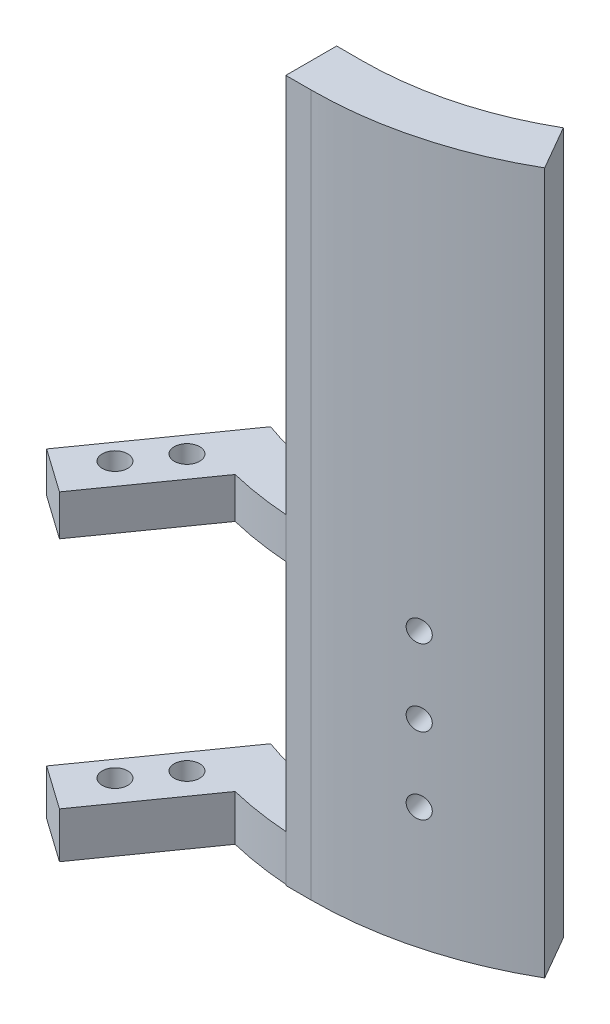
from build123d import *

# Parameters (mm, degrees)
BOSS_EXTRUDE2_DEPTH = 20
FILLET1_RADIUS      = 10
FILLET1_LENGTH      = 5
FILLET2_RADIUS      = 10
FILLET2_LENGTH      = 5
SKETCH5_R           = 1
SKETCH5_R_2         = 5.5
CUT_EXTRUDE5_DEPTH  = 69.007352544
CUT_EXTRUDE7_DEPTH  = 25
FILLET5_R           = 10
BOSS_EXTRUDE5_DEPTH = 60
SKETCH13_R          = 2.1
CUT_EXTRUDE8_DEPTH  = 60
CUT_EXTRUDE9_DEPTH  = 60
CUT_EXTRUDE10_DEPTH = 60
SKETCH17_R          = 2.5
BOSS_EXTRUDE6_DEPTH = 8
SKETCH18_R          = 2.5
BOSS_EXTRUDE7_DEPTH = 9
BOSS_EXTRUDE8_DEPTH = 69


with BuildPart() as part:
    # Sketch1 → Boss-Extrude2 (new body)
    with BuildSketch(Plane.XY):
        Polygon((-25, 30), (25, 30), (25, -30), (-25, -30), (-25, -25), (-20, -25), (20, -25), (20, 25), (-20, 25), (-25, 25), align=None)
    extrude(amount=BOSS_EXTRUDE2_DEPTH)

    # Fillet1: full round fillet: the end face becomes a half cylinder, R = half its width
    fillet1_face = Plane((-25, 27.5, 10), x_dir=(0, -1, 0), z_dir=(-1, 0, 0))  # on the end face: x along it, z out of the body
    fillet1_slab = fillet1_face.offset(-FILLET1_RADIUS / 2) * Box(FILLET1_LENGTH, 2 * FILLET1_RADIUS, FILLET1_RADIUS, mode=Mode.PRIVATE)  # the body's end, R deep
    fillet1_round = Plane((-15, 27.5, 10), x_dir=(-1, 0, 0), z_dir=(0, -1, 0)) * Cylinder(FILLET1_RADIUS, FILLET1_LENGTH, mode=Mode.PRIVATE)  # its axis R under the face
    add(fillet1_slab - fillet1_round, mode=Mode.SUBTRACT)

    # Fillet2: full round fillet: the end face becomes a half cylinder, R = half its width
    fillet2_face = Plane((-25, -27.5, 10), x_dir=(0, -1, 0), z_dir=(-1, 0, 0))  # on the end face: x along it, z out of the body
    fillet2_slab = fillet2_face.offset(-FILLET2_RADIUS / 2) * Box(FILLET2_LENGTH, 2 * FILLET2_RADIUS, FILLET2_RADIUS, mode=Mode.PRIVATE)  # the body's end, R deep
    fillet2_round = Plane((-15, -27.5, 10), x_dir=(-1, 0, 0), z_dir=(0, -1, 0)) * Cylinder(FILLET2_RADIUS, FILLET2_LENGTH, mode=Mode.PRIVATE)  # its axis R under the face
    add(fillet2_slab - fillet2_round, mode=Mode.SUBTRACT)

    # Sketch5 → Cut-Extrude5 (cut, through all)
    with BuildSketch(Plane(origin=(0, 30, 0), x_dir=(1, 0, 0), z_dir=(0, 1, 0))):
        with Locations(Location((-15, -3, 0), (0, 0, 180))):
            Circle(SKETCH5_R)
        with Locations(Location((-22, -10, 0), (0, 0, 180))):
            Circle(SKETCH5_R)
        with Locations(Location((-15, -17, 0), (0, 0, 180))):
            Circle(SKETCH5_R)
        with Locations(Location((-8, -10, 0), (0, 0, 180))):
            Circle(SKETCH5_R)
        with Locations(Location((-15, -10, 0), (0, 0, 180))):
            Circle(SKETCH5_R_2)
    extrude(amount=-CUT_EXTRUDE5_DEPTH, mode=Mode.SUBTRACT)

    # Sketch10 → Cut-Extrude7 (cut)
    with BuildSketch(Plane(origin=(25, 0, 0), x_dir=(0, 0, -1), z_dir=(1, 0, 0))):
        Polygon((-15, 28.180148829), (-15, -28.180148829), (-15, -30), (-20, -30), (-20, 30), (-15, 30), align=None)
        Polygon((-5, 28.180148829), (-5, -28.180148829), (-5, -30), (0, -30), (0, 30), (-5, 30), align=None)
    extrude(amount=-CUT_EXTRUDE7_DEPTH, mode=Mode.SUBTRACT)

    # Fillet5
    # the kernel refuses this fillet: 10 mm, written as the material it adds along each edge
    with BuildSketch(Plane(origin=(0, 25, 15), x_dir=(1, 0, 0), z_dir=(0, 1, 0)), Plane(origin=(0, -30, 15), x_dir=(1, 0, 0), z_dir=(0, 1, 0)), Plane(origin=(0, -25, 5), x_dir=(1, 0, 0), z_dir=(0, -1, 0))) as fillet5_piece_1:
        with BuildLine():
            CenterArc((8.660254038, -10), FILLET5_R, 90, 60)
            Line((0, -5), (-0.173205081, -4.9))
            ThreePointArc((-0.173205081, -4.9), (-0.2, -2.5), (-0.2, 0))
            Line((-0.2, 0), (0, 0.2))
            Line((0, 0.2), (8.660254038, 0.2))
            Line((8.660254038, 0.2), (8.660254038, 0))
        make_face()
    extrude(amount=5)
    with BuildSketch(Plane(origin=(0, 30, 5), x_dir=(0, 0, -1), z_dir=(0, -1, 0))) as fillet5_piece_2:
        with BuildLine():
            CenterArc((10, 8.660254038), FILLET5_R, 180, 60)
            Line((0, 8.660254038), (-0.2, 8.660254038))
            Line((-0.2, 8.660254038), (-0.2, 0))
            Line((-0.2, 0), (0, -0.2))
            ThreePointArc((0, -0.2), (2.5, -0.2), (4.9, -0.173205081))
            Line((4.9, -0.173205081), (5, 0))
        make_face()
    extrude(amount=5)

    # Sketch12 → Boss-Extrude5 (add)
    with BuildSketch(Plane.XZ.offset(30)):
        with BuildLine():
            Line((56.226298398, -3.359735054), (61.222506141, 5.302707337))
            ThreePointArc((61.222506141, 5.302707337), (43.74904955, 12.533728595), (25, 15))
            Line((25, 15), (25, 5))
            ThreePointArc((25, 5), (41.16297375, 2.873903962), (56.226298398, -3.359735054))
        make_face()
    extrude(amount=-BOSS_EXTRUDE5_DEPTH)

    # Sketch13 → Cut-Extrude8 (cut)
    with BuildSketch(Plane(origin=(2.920998947, 0, 10.910870277), x_dir=(-0.9659824633840055, 0, 0.2586075800021504), z_dir=(-0.2586075800021504, 0, -0.9659824633840055))):
        with Locations((-39.019497435, 15)):
            Circle(SKETCH13_R)
        with Locations((-39.019497435, 0)):
            Circle(SKETCH13_R)
        with Locations((-39.019497435, -15)):
            Circle(SKETCH13_R)
    extrude(amount=-CUT_EXTRUDE8_DEPTH, mode=Mode.SUBTRACT)

    # Sketch15 → Cut-Extrude9 (cut)
    with BuildSketch(Plane(origin=(0, 30, 0), x_dir=(1, 0, 0), z_dir=(0, 1, 0))):
        with BuildLine():
            Line((8.660254038, -5), (8.660254038, -15))
            ThreePointArc((8.660254038, -15), (-39.182795974, -10), (8.660254038, -5))
        make_face()
    extrude(amount=-CUT_EXTRUDE9_DEPTH, mode=Mode.SUBTRACT)

    # Sketch16 → Cut-Extrude10 (cut)
    with BuildSketch(Plane(origin=(0, 30, 0), x_dir=(1, 0, 0), z_dir=(0, 1, 0))):
        Polygon((-6.307906019, -33.220384693), (8.660254038, -15), (20.000254038, -15), (20.000254038, -5), (8.660254038, -5), (3.496355525, -1.350438774), (-14.790578774, -27.225295226), align=None)
    extrude(amount=-CUT_EXTRUDE10_DEPTH, mode=Mode.SUBTRACT)

    # Sketch17 → Boss-Extrude6 (add)
    # profile 1 of 2: a face of its own
    with BuildSketch(Plane(origin=(0, 16, 0), x_dir=(1, 0, 0), z_dir=(0, 1, 0))):
        Polygon((2.432023453, -2.661202229), (-1.062108246, -7.605177784), (-12.605177784, -23.937891754), (-14.882580853, -27.160273185), (-8.757813114, -31.488924262), (-6.307906019, -33.220384693), (7.998117102, -12.978265997), (11.006698288, -8.721313737), align=None)
        with Locations(Location((-6.090722034, -22.517234763, 0), (0, 0, 180))):
            Circle(SKETCH17_R, mode=Mode.SUBTRACT)
        with Locations(Location((-0.226842709, -14.220216066, 0), (0, 0, 180))):
            Circle(SKETCH17_R, mode=Mode.SUBTRACT)
    # profile 2 of 2: a face of its own
    with BuildSketch(Plane(origin=(0, 16, 0), x_dir=(1, 0, 0), z_dir=(0, 1, 0))):
        with BuildLine():
            Line((3.360713643, -1.347164296), (2.432023453, -2.661202229))
            Line((2.432023453, -2.661202229), (11.006698288, -8.721313737))
            Line((11.006698288, -8.721313737), (7.998117102, -12.978265997))
            ThreePointArc((7.998117102, -12.978265997), (13.960401245, -14.154569005), (20.000254038, -14.827398269))
            Line((20.000254038, -14.827398269), (20.000254038, -5))
            ThreePointArc((20.000254038, -5), (11.555844657, -3.741343444), (3.360713643, -1.347164296))
        make_face()
    extrude(amount=BOSS_EXTRUDE6_DEPTH)

    # Sketch18 → Boss-Extrude7 (add)
    with BuildSketch(Plane(origin=(0, -39, 0), x_dir=(1, 0, 0), z_dir=(0, 1, 0))):
        with BuildLine():
            Line((3.360713643, -1.347164296), (-14.882580853, -27.160273185))
            Line((-14.882580853, -27.160273185), (-6.307906019, -33.220384693))
            Line((-6.307906019, -33.220384693), (7.998117102, -12.978265997))
            ThreePointArc((7.998117102, -12.978265997), (13.960401245, -14.154569005), (20.000254038, -14.827398269))
            Line((20.000254038, -14.827398269), (20.000254038, -15))
            Line((20.000254038, -15), (25, -15))
            ThreePointArc((25, -15), (43.74904955, -12.533728595), (61.222506141, -5.302707337))
            Line((61.222506141, -5.302707337), (56.226298398, 3.359735054))
            ThreePointArc((56.226298398, 3.359735054), (41.16297375, -2.873903962), (25, -5))
            Line((25, -5), (20.000254038, -5))
            ThreePointArc((20.000254038, -5), (11.555844657, -3.741343444), (3.360713643, -1.347164296))
        make_face()
        with Locations(Location((-6.090722034, -22.517234763, 0), (0, 0, 180))):
            Circle(SKETCH18_R, mode=Mode.SUBTRACT)
        with Locations(Location((-0.226842709, -14.220216066, 0), (0, 0, 180))):
            Circle(SKETCH18_R, mode=Mode.SUBTRACT)
    extrude(amount=BOSS_EXTRUDE7_DEPTH)

    # Sketch19 → Boss-Extrude8 (add)
    with BuildSketch(Plane(origin=(0, 30, 0), x_dir=(1, 0, 0), z_dir=(0, 1, 0))):
        with BuildLine():
            Line((56.226298398, 3.359735054), (61.222506141, -5.302707337))
            ThreePointArc((61.222506141, -5.302707337), (43.74904955, -12.533728595), (25, -15))
            Line((25, -15), (20.000254038, -15))
            Line((20.000254038, -15), (20.000254038, -5))
            Line((20.000254038, -5), (25, -5))
            ThreePointArc((25, -5), (41.16297375, -2.873903962), (56.226298398, 3.359735054))
        make_face()
    extrude(amount=BOSS_EXTRUDE8_DEPTH)


solid = part.part
